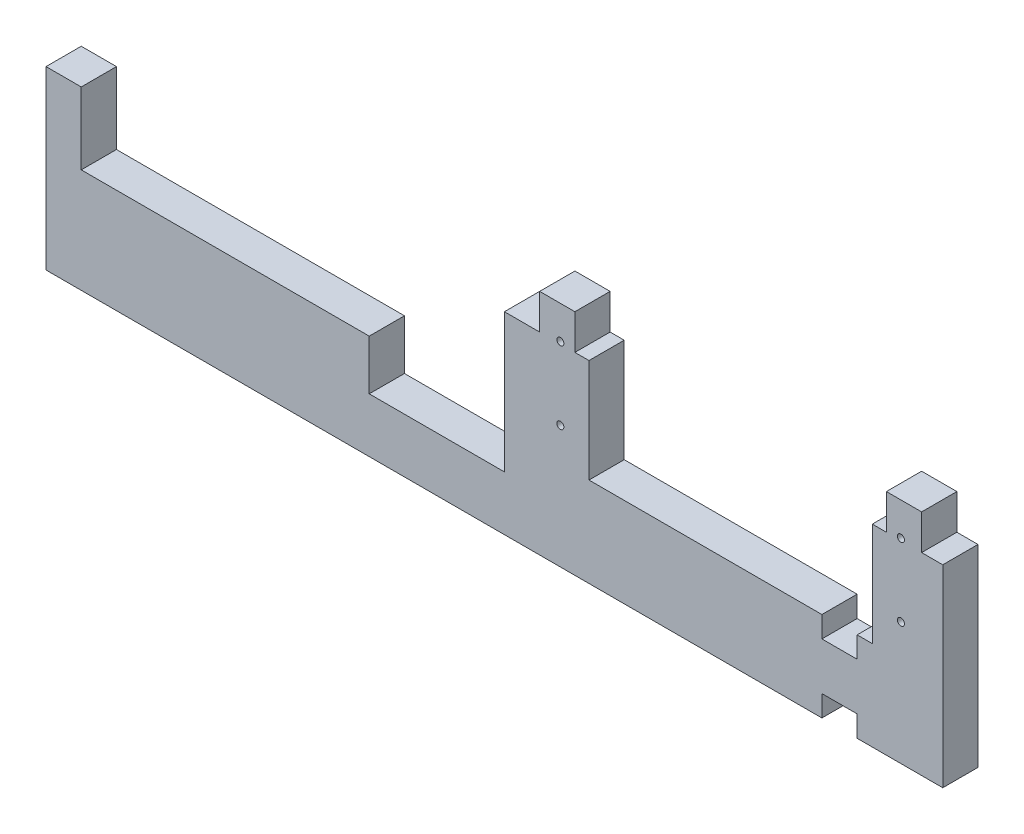
from build123d import *

# Parameters (mm, degrees)
BOSS_EXTRU_1_DEPTH = 5
ESQUISSE2_W        = 5
ESQUISSE2_H        = 3
ESQUISSE2_W_2      = 3
ESQUISSE2_H_2      = 5
ESQUISSE2_W_3      = 2
CR_NEAUX_DEPTH     = 5
ESQUISSE3_R        = 0.5
PER_AGES_DEPTH     = 5


with BuildPart() as part:
    # Esquisse1 → Boss.-Extru.1 (new body)
    with BuildSketch(Plane.XY):
        Polygon((-40.2, 0), (-40.2, -19.685), (0, -19.685), (0, 0), (10, 0), (10, -32.401636706), (-117.248553715, -32.401636706), (-117.248553715, -7.401636706), (-112.246954868, -7.401636706), (-112.246954868, -17.5925), (-71.384202009, -17.5925), (-71.384202009, -24.685), (-52.2, -24.685), (-52.2, 0), align=None)
    extrude(amount=BOSS_EXTRU_1_DEPTH)

    # Esquisse2 → Créneaux - (cut)
    with BuildSketch(Plane(origin=(0, 0, 0), x_dir=(-1, 0, 0), z_dir=(0, 0, -1))):
        with Locations((4.65, -21.185)):
            Rectangle(ESQUISSE2_W, ESQUISSE2_H)
        with Locations((4.65, -30.901636706)):
            Rectangle(ESQUISSE2_W, ESQUISSE2_H)
        with Locations((-8.5, -2.5)):
            Rectangle(ESQUISSE2_W_2, ESQUISSE2_H_2)
        with Locations((-1, -2.5)):
            Rectangle(ESQUISSE2_W_3, ESQUISSE2_H_2)
        with Locations((41.2, -2.5)):
            Rectangle(ESQUISSE2_W_3, ESQUISSE2_H_2)
        with Locations((49.7, -2.5)):
            Rectangle(ESQUISSE2_W, ESQUISSE2_H_2)
    extrude(amount=-CR_NEAUX_DEPTH, mode=Mode.SUBTRACT)

    # Esquisse3 → Perçages (cut)
    with BuildSketch(Plane(origin=(0, 0, 0), x_dir=(-1, 0, 0), z_dir=(0, 0, -1))):
        with Locations((-4.064, -14.986)):
            Circle(ESQUISSE3_R)
        with Locations((-4.064, -4.699)):
            Circle(ESQUISSE3_R)
        with Locations((44.264, -14.986)):
            Circle(ESQUISSE3_R)
        with Locations((44.264, -4.699)):
            Circle(ESQUISSE3_R)
    extrude(amount=-PER_AGES_DEPTH, mode=Mode.SUBTRACT)


solid = part.part
